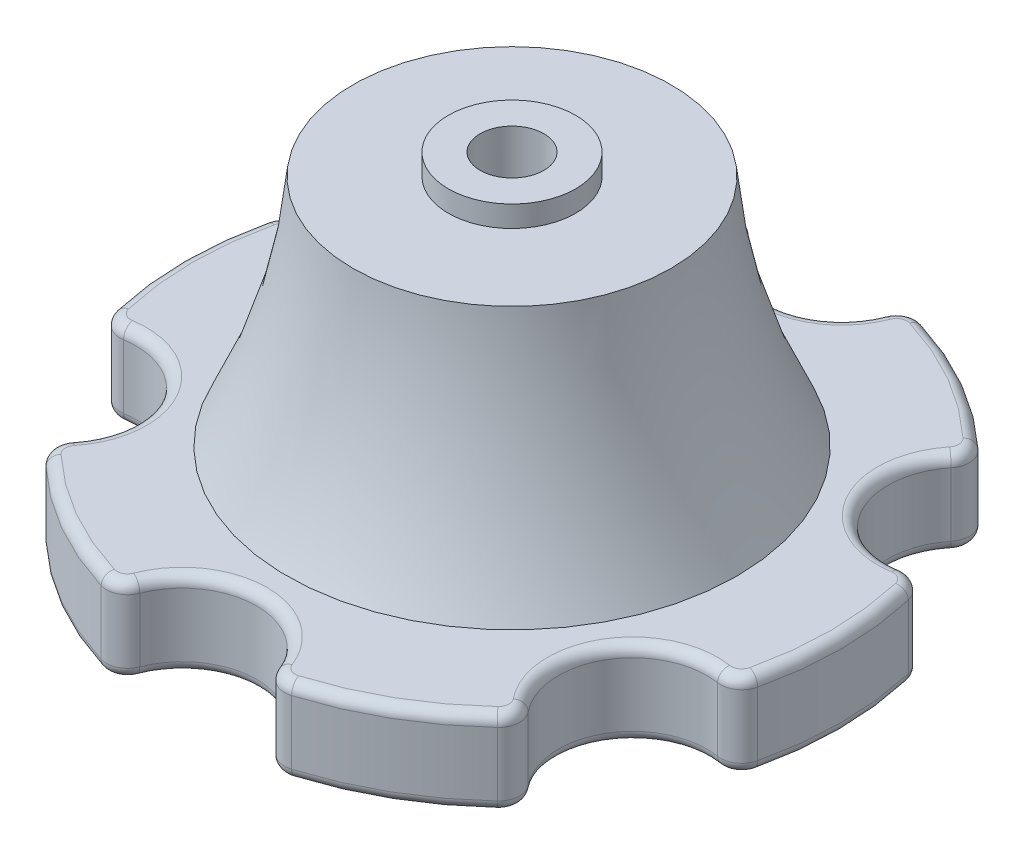
from build123d import *

# Parameters (mm, degrees)
EXTRUDE_1_DEPTH     = 15
SKETCH_3_R          = 1.5
CUT_EXTRUDE_1_DEPTH = 15
SKETCH_4_R          = 3
CUT_EXTRUDE_2_DEPTH = 6
FILLET_1_R          = 1
FILLET_2_R          = 0.5
SKETCH_5_R          = 3
SKETCH_5_R_2        = 1.5
EXTRUDE_2_DEPTH     = 1


with BuildPart() as part:
    # Эскиз1 → Бобышка-Вытянуть1 (new body)
    with BuildSketch(Plane(origin=(0, 0, 0), x_dir=(1, 0, 0), z_dir=(0, 1, 0))):
        with BuildLine():
            ThreePointArc((-3.477707616, 15.135602061), (0, 12.03), (3.477707616, 15.135602061))
            ThreePointArc((3.477707616, 15.135602061), (7.765, 13.449374521), (11.368962078, 10.579584173))
            ThreePointArc((11.368962078, 10.579584173), (10.418285608, 6.015), (14.846669694, 4.556017888))
            ThreePointArc((14.846669694, 4.556017888), (15.53, 0), (14.846669694, -4.556017888))
            ThreePointArc((14.846669694, -4.556017888), (10.418285608, -6.015), (11.368962078, -10.579584173))
            ThreePointArc((11.368962078, -10.579584173), (7.765, -13.449374521), (3.477707616, -15.135602061))
            ThreePointArc((3.477707616, -15.135602061), (0, -12.03), (-3.477707616, -15.135602061))
            ThreePointArc((-3.477707616, -15.135602061), (-7.765, -13.449374521), (-11.368962078, -10.579584173))
            ThreePointArc((-11.368962078, -10.579584173), (-10.418285608, -6.015), (-14.846669694, -4.556017888))
            ThreePointArc((-14.846669694, -4.556017888), (-15.53, 0), (-14.846669694, 4.556017888))
            ThreePointArc((-14.846669694, 4.556017888), (-10.418285608, 6.015), (-11.368962078, 10.579584173))
            ThreePointArc((-11.368962078, 10.579584173), (-7.765, 13.449374521), (-3.477707616, 15.135602061))
        make_face()
    extrude(amount=EXTRUDE_1_DEPTH)

    # Эскиз2 → Вырез-Повернуть1 (revolve, cut)
    with BuildSketch(Plane.XY):
        with BuildLine():
            Line((-15.6, 31), (-15.6, 4))
            Line((-15.6, 4), (-10.6, 4))
            ThreePointArc((-10.6, 4), (-7.390856649, 17.5), (-10.6, 31))
            Line((-10.6, 31), (-15.6, 31))
        make_face()
    revolve(axis=Axis((0, -1000, 0), (0, 1, 0)), mode=Mode.SUBTRACT)

    # Эскиз3 → Вырез-Вытянуть1 (cut)
    with BuildSketch(Plane.XZ):
        Circle(SKETCH_3_R)
    extrude(amount=-CUT_EXTRUDE_1_DEPTH, mode=Mode.SUBTRACT)

    # Эскиз4 → Вырез-Вытянуть2 (cut)
    with BuildSketch(Plane.XZ):
        Circle(SKETCH_4_R)
    extrude(amount=-CUT_EXTRUDE_2_DEPTH, mode=Mode.SUBTRACT)

    # Скругление1
    fillet_1_edges = [part.edges().sort_by_distance(p)[0] for p in [
        (-11.368962078, 2, 10.579584173),
        (-3.477707616, 2, 15.135602061),
        (3.477707616, 2, 15.135602061),
        (11.368962078, 2, 10.579584173),
        (14.846669694, 2, 4.556017888),
        (14.846669694, 2, -4.556017888),
        (11.368962078, 2, -10.579584173),
        (-3.477707616, 2, -15.135602061),
        (3.477707616, 2, -15.135602061),
        (-11.368962078, 2, -10.579584173),
        (-14.846669694, 2, -4.556017888),
        (-14.846669694, 2, 4.556017888),
    ]]
    fillet(fillet_1_edges, radius=FILLET_1_R)

    # Скругление2
    fillet_2_edges = [part.edges().sort_by_distance(p)[0] for p in [
        (3.759155616, 4, 14.808611742),
        (0, 4, 12.03),
        (-3.759155616, 4, 14.808611742),
        (-7.765, 4, 13.449374521),
        (-10.945056155, 4, 10.659830131),
        (-10.418285608, 4, 6.015),
        (-14.704211771, 4, 4.148781611),
        (-15.53, 4, 0),
        (-14.704211771, 4, -4.148781611),
        (-10.418285608, 4, -6.015),
        (-10.945056155, 4, -10.659830131),
        (-7.765, 4, -13.449374521),
        (-3.759155616, 4, -14.808611742),
        (0, 4, -12.03),
        (3.759155616, 4, -14.808611742),
        (7.765, 4, -13.449374521),
        (10.945056155, 4, -10.659830131),
        (10.418285608, 4, -6.015),
        (14.704211771, 4, -4.148781611),
        (15.53, 4, 0),
        (14.704211771, 4, 4.148781611),
        (10.418285608, 4, 6.015),
        (10.945056155, 4, 10.659830131),
        (-10.945056155, 0, 10.659830131),
        (-10.418285608, 0, 6.015),
        (-14.704211771, 0, 4.148781611),
        (-15.53, 0, 0),
        (-14.704211771, 0, -4.148781611),
        (-10.418285608, 0, -6.015),
        (-10.945056155, 0, -10.659830131),
        (-7.765, 0, -13.449374521),
        (-3.759155616, 0, -14.808611742),
        (0, 0, -12.03),
        (3.759155616, 0, -14.808611742),
        (7.765, 0, -13.449374521),
        (10.945056155, 0, -10.659830131),
        (10.418285608, 0, -6.015),
        (14.704211771, 0, -4.148781611),
        (15.53, 0, 0),
        (14.704211771, 0, 4.148781611),
        (10.418285608, 0, 6.015),
        (10.945056155, 0, 10.659830131),
        (7.765, 0, 13.449374521),
        (3.759155616, 0, 14.808611742),
        (0, 0, 12.03),
        (-3.759155616, 0, 14.808611742),
        (7.765, 4, 13.449374521),
        (-7.765, 0, 13.449374521),
    ]]
    fillet(fillet_2_edges, radius=FILLET_2_R)

    # Эскиз5 → Бобышка-Вытянуть2 (add)
    with BuildSketch(Plane(origin=(0, 15, 0), x_dir=(1, 0, 0), z_dir=(0, 1, 0))):
        Circle(SKETCH_5_R)
        Circle(SKETCH_5_R_2, mode=Mode.SUBTRACT)
    extrude(amount=EXTRUDE_2_DEPTH)


solid = part.part
